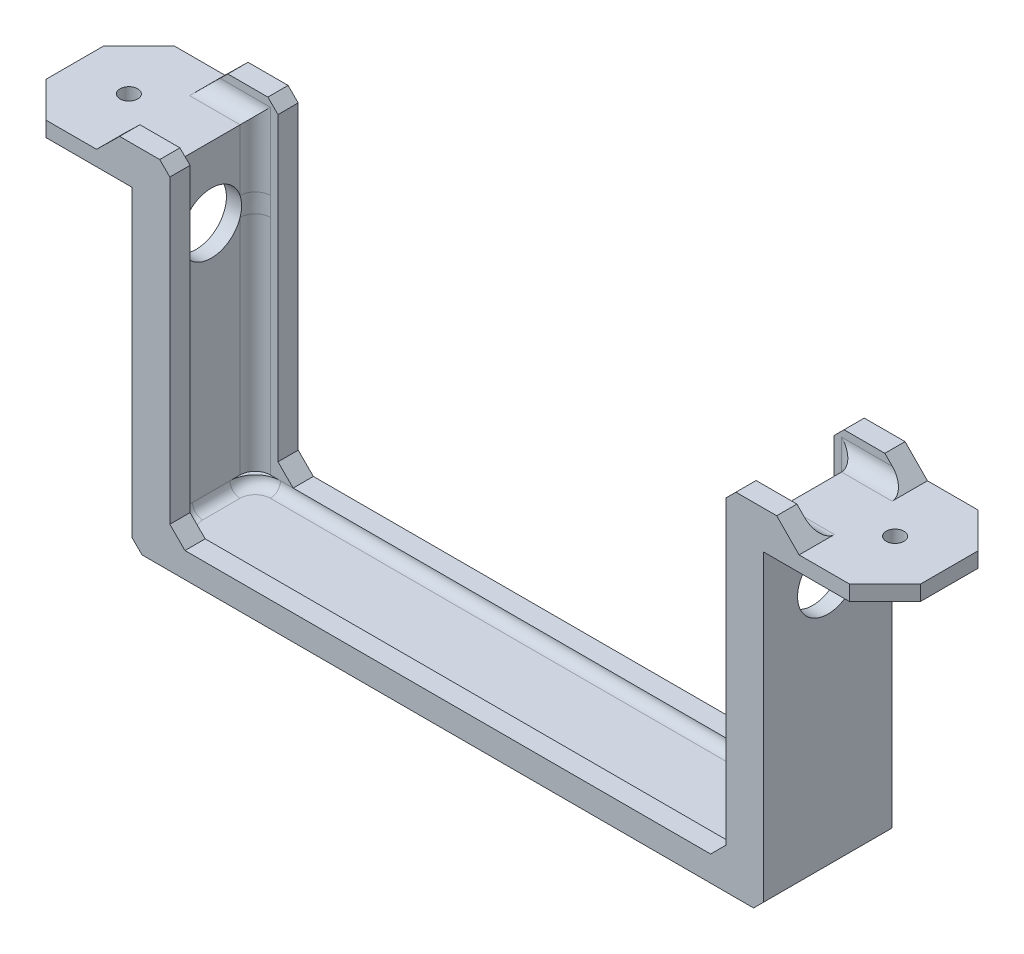
from build123d import *

# Parameters (mm, degrees)
SKETCH1_W           = 125
SKETCH1_H           = 25.4
BOSS_EXTRUDE1_DEPTH = 5
SKETCH2_W           = 119
SKETCH2_H           = 17.4
CUT_EXTRUDE1_DEPTH  = 2
FILLET1_R           = 5
SKETCH3_W           = 3
SKETCH3_H           = 25.4
BOSS_EXTRUDE2_DEPTH = 60
CHAMFER1_SIZE       = 2
SKETCH4_R           = 6
CUT_EXTRUDE3_DEPTH  = 135.4
SKETCH5_W           = 25.4
SKETCH5_H           = 3
BOSS_EXTRUDE3_DEPTH = 24
SKETCH6_W           = 25.4
SKETCH6_H           = 3
BOSS_EXTRUDE4_DEPTH = 24
SKETCH9_R           = 1.75
CUT_EXTRUDE4_DEPTH  = 4
CHAMFER2_SIZE       = 7
BOSS_EXTRUDE5_DEPTH = 4
BOSS_EXTRUDE6_DEPTH = 4
CHAMFER3_SIZE       = 2
CHAMFER4_SIZE       = 3
FILLET5_R           = 2
FILLET6_R           = 3


# Some blends are built 0.0001 mm under size
with BuildPart() as part:
    # Sketch1 → Boss-Extrude1 (new body)
    with BuildSketch(Plane(origin=(0, 0, 0), x_dir=(1, 0, 0), z_dir=(0, 1, 0))):
        Rectangle(SKETCH1_W, SKETCH1_H)
    extrude(amount=BOSS_EXTRUDE1_DEPTH)

    # Sketch2 → Cut-Extrude1 (cut)
    with BuildSketch(Plane(origin=(0, 5, 0), x_dir=(1, 0, 0), z_dir=(0, 1, 0))):
        Rectangle(SKETCH2_W, SKETCH2_H)
    extrude(amount=-CUT_EXTRUDE1_DEPTH, mode=Mode.SUBTRACT)

    # Fillet1
    fillet1_edges = [part.edges().sort_by_distance(p)[0] for p in [
        (59.5, 4, -8.7),
        (59.5, 4, 8.7),
        (-59.5, 4, 8.7),
        (-59.5, 4, -8.7),
    ]]
    fillet(fillet1_edges, radius=FILLET1_R)

    # Sketch3 → Boss-Extrude2 (add)
    with BuildSketch(Plane(origin=(0, 5, 0), x_dir=(1, 0, 0), z_dir=(0, 1, 0))):
        with Locations((61, 0)):
            Rectangle(SKETCH3_W, SKETCH3_H)
        with Locations((-61, 0)):
            Rectangle(SKETCH3_W, SKETCH3_H)
    extrude(amount=BOSS_EXTRUDE2_DEPTH)

    # Chamfer1
    chamfer1_edges = [part.edges().sort_by_distance(p)[0] for p in [
        (-62.5, 0, 0),
        (62.5, 0, 0),
    ]]
    chamfer(chamfer1_edges, length=CHAMFER1_SIZE)

    # Sketch4 → Cut-Extrude3 (cut)
    with BuildSketch(Plane(origin=(62.5, 0, 0), x_dir=(0, 0, -1), z_dir=(1, 0, 0))):
        with Locations((0, 51)):
            Circle(SKETCH4_R)
    extrude(amount=-CUT_EXTRUDE3_DEPTH, mode=Mode.SUBTRACT)

    # Sketch5 → Boss-Extrude3 (add)
    with BuildSketch(Plane.ZY.offset(62.5)):
        with Locations((0, 63.5)):
            Rectangle(SKETCH5_W, SKETCH5_H)
    extrude(amount=BOSS_EXTRUDE3_DEPTH)

    # Sketch6 → Boss-Extrude4 (add)
    with BuildSketch(Plane(origin=(62.5, 0, 0), x_dir=(0, 0, -1), z_dir=(1, 0, 0))):
        with Locations((0, 63.5)):
            Rectangle(SKETCH6_W, SKETCH6_H)
    extrude(amount=BOSS_EXTRUDE4_DEPTH)

    # Sketch9 → Cut-Extrude4 (cut)
    with BuildSketch(Plane(origin=(0, 65, 0), x_dir=(1, 0, 0), z_dir=(0, 1, 0))):
        with Locations(Location((75.8, 0, 0), (0, 0, 270))):
            Circle(SKETCH9_R)
        with Locations(Location((-75.8, 0, 0), (0, 0, 270))):
            Circle(SKETCH9_R)
    extrude(amount=-CUT_EXTRUDE4_DEPTH, mode=Mode.SUBTRACT)

    # Chamfer2
    chamfer2_edges = [part.edges().sort_by_distance(p)[0] for p in [
        (-86.5, 63.5, -12.7),
        (-86.5, 63.5, 12.7),
        (86.5, 63.5, 12.7),
        (86.5, 63.5, -12.7),
    ]]
    chamfer(chamfer2_edges, length=CHAMFER2_SIZE)

    # Sketch10 → Boss-Extrude5 (add)
    with BuildSketch(Plane.XY.offset(12.7)):
        Polygon((-69.5, 65), (-64.924872653, 69.5), (-55, 69.5), (-55, 5), (-59.5, 5), (-59.5, 65), align=None)
        Polygon((69.5, 65), (65.073893694, 69.5), (55, 69.5), (55, 5), (59.5, 5), (59.5, 65), align=None)
    extrude(amount=-BOSS_EXTRUDE5_DEPTH)

    # Sketch11 → Boss-Extrude6 (add)
    with BuildSketch(Plane(origin=(0, 0, -12.7), x_dir=(-1, 0, 0), z_dir=(0, 0, -1))):
        Polygon((-69.5, 65), (-65.073893694, 69.5), (-55, 69.5), (-55, 5), (-59.5, 5), (-59.5, 65), align=None)
        Polygon((69.5, 65), (64.924872653, 69.5), (55, 69.5), (55, 5), (59.5, 5), (59.5, 65), align=None)
    extrude(amount=-BOSS_EXTRUDE6_DEPTH)

    # Chamfer3
    chamfer3_edges = [part.edges().sort_by_distance(p)[0] for p in [
        (-55, 69.5, 10.7),
        (55, 69.5, 10.7),
        (55, 69.5, -10.7),
        (-55, 69.5, -10.7),
    ]]
    chamfer(chamfer3_edges, length=CHAMFER3_SIZE)

    # Chamfer4
    # the kernel refuses this chamfer: 3 mm, written as the material it adds along each edge
    with BuildSketch(Plane(origin=(-55, 5, 12.7), x_dir=(-0.02749587661058672, 0.9996219169112968, 0), z_dir=(0, 0, -1)), Plane(origin=(55, 5, 12.7), x_dir=(-0.9996219169112968, -0.02749587661058648, 0), z_dir=(0, 0, -1)), Plane(origin=(-55, 5, -12.7), x_dir=(0.9996219169112968, -0.02749587661058648, 0), z_dir=(0, 0, 1))) as chamfer4_piece_1:
        Polygon((CHAMFER4_SIZE * 0.999621916911, CHAMFER4_SIZE * 0.0274958766106), (-CHAMFER4_SIZE * 0.0274958766106, CHAMFER4_SIZE * 0.999621916911), (0, 0), align=None)
    extrude(amount=4)
    with BuildSketch(Plane(origin=(55, 5, -12.7), x_dir=(-0.9996219169112968, -0.02749587661058648, 0), z_dir=(0, 0, 1))) as chamfer4_piece_2:
        Polygon((CHAMFER4_SIZE * 0.999621916911, -CHAMFER4_SIZE * 0.0274958766106), (-CHAMFER4_SIZE * 0.0274958766106, -CHAMFER4_SIZE * 0.999621916911), (0, 0), align=None)
    extrude(amount=4)

    # Fillet5
    fillet5_edges = [part.edges().sort_by_distance(p)[0] for p in [
        (-58.035533906, 3, 7.235533906),
        (-59.5, 3, 0),
        (-58.035533906, 3, -7.235533906),
        (0, 3, -8.7),
        (58.035533906, 3, -7.235533906),
        (59.5, 3, 0),
        (58.035533906, 3, 7.235533906),
        (0, 3, 8.7),
    ]]
    fillet(fillet5_edges, radius=FILLET5_R - 0.0001)  # a hair under: the kernel refuses the full size

    # Fillet6
    fillet6_edges = [part.edges().sort_by_distance(p)[0] for p in [
        (-64.5, 65, 8.7),
        (-59.5, 35, 8.7),
        (64.5, 65, 8.7),
        (59.5, 35, 8.7),
        (64.5, 65, -8.7),
        (59.5, 35, -8.7),
        (-64.5, 65, -8.7),
        (-59.5, 35, -8.7),
    ]]
    fillet(fillet6_edges, radius=FILLET6_R)


solid = part.part
